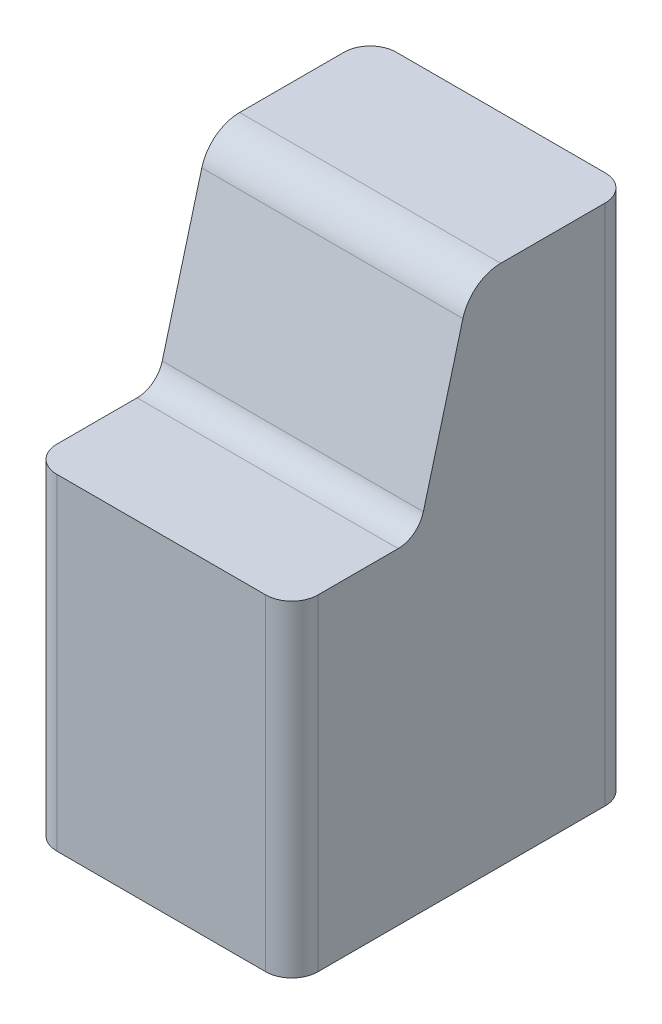
from build123d import *

# Parameters (mm, degrees)
BOSS_EXTRUDE1_DEPTH         = 10
FILLET1_R                   = 2
M6_TAPPED_HOLE1_D           = 5
M6_TAPPED_HOLE1_DEPTH       = 17
M6_TAPPED_HOLE1_CSINK_D     = 6.05
M6_TAPPED_HOLE1_CSINK_ANGLE = 90
M6_TAPPED_HOLE1_TIP         = 1.502151548
FILLET2_R                   = 2


with BuildPart() as part:
    # Sketch1 → Boss-Extrude1 (new, symmetric)
    with BuildSketch(Plane(origin=(0, 0, 0), x_dir=(0, 0, -1), z_dir=(1, 0, 0))):
        with BuildLine():
            Line((-10, 0), (0, 0))
            Line((0, 0), (0, -40))
            Line((0, -40), (-26, -40))
            Line((-26, -40), (-26, -15))
            Line((-26, -15), (-16.32121885, -15))
            Line((-16.32121885, -15), (-12.897777479, -2.223542865))
            ThreePointArc((-12.897777479, -2.223542865), (-11.826284287, -0.619939979), (-10, 0))
        make_face()
    extrude(amount=BOSS_EXTRUDE1_DEPTH, both=True)

    # Fillet1
    fillet1_edges = [part.edges().sort_by_distance(p)[0] for p in [
        (-10, -20, 0),
        (-10, -27.5, 26),
        (10, -20, 0),
        (10, -27.5, 26),
    ]]
    fillet(fillet1_edges, radius=FILLET1_R)

    # M6 Tapped Hole1
    with Locations(Plane(origin=(0, -40, 0), x_dir=(-1, 0, 0), z_dir=(0, -1, 0))):
        with Locations((0, -7.5)):
            CounterSinkHole(M6_TAPPED_HOLE1_D / 2, M6_TAPPED_HOLE1_CSINK_D / 2, depth=M6_TAPPED_HOLE1_DEPTH, counter_sink_angle=M6_TAPPED_HOLE1_CSINK_ANGLE)
            with Locations((0, 0, -(M6_TAPPED_HOLE1_DEPTH + M6_TAPPED_HOLE1_TIP / 2))):  # 118° drill point
                Cone(0, M6_TAPPED_HOLE1_D / 2, M6_TAPPED_HOLE1_TIP, mode=Mode.SUBTRACT)

    # Fillet2
    fillet2_edges = [part.edges().sort_by_distance(p)[0] for p in [
        (0, -15, 16.32121885),
    ]]
    fillet(fillet2_edges, radius=FILLET2_R)


solid = part.part
